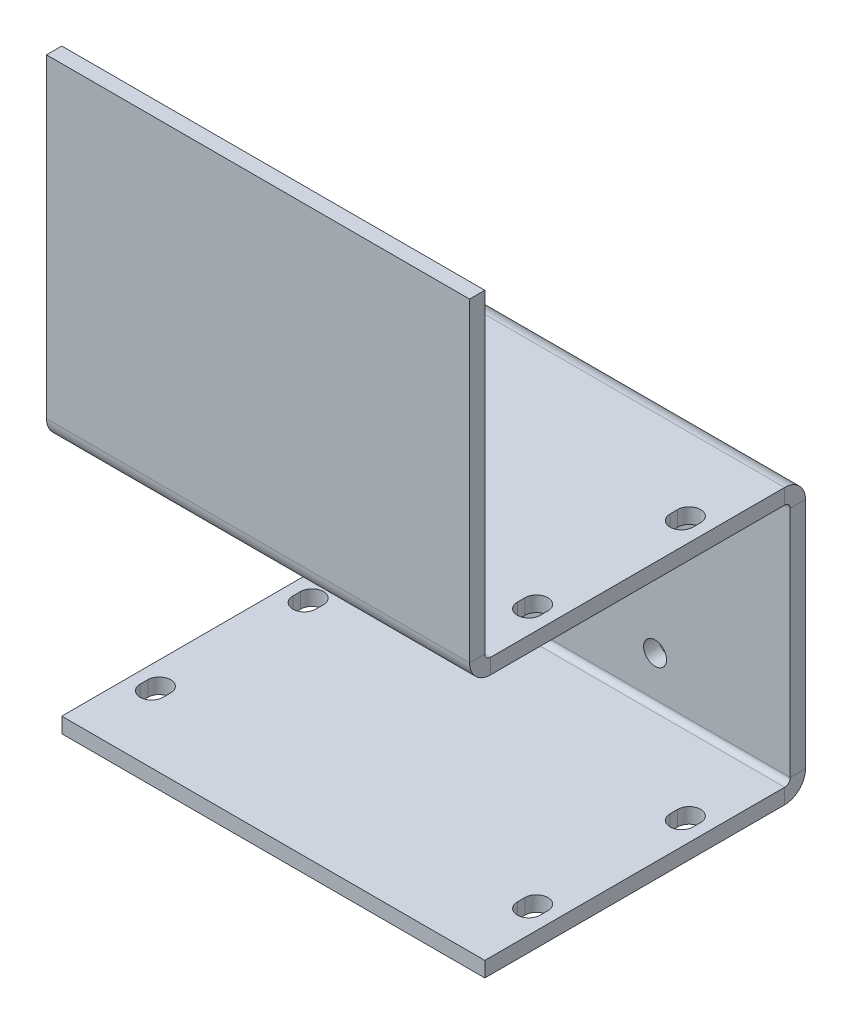
from build123d import *

# Parameters (mm, degrees)
SZKIC1_W                             = 55.4
SZKIC1_H                             = 32
ODGI_CIE_BAZOWE1_DEPTH               = 2
OTWORY_USTALAJ_CE_3_0MM1_D           = 3
OTWORY_USTALAJ_CE_3_0MM1_DEPTH       = 17
OTWORY_USTALAJ_CE_3_0MM1_TIP         = 0.901290929
ODGI_CIE_KRAW_DZI1_STRIP_W           = 9.4732
ODGI_CIE_KRAW_DZI1_STRIP_H           = 2
ODGI_CIE_KRAW_DZI1_STRIP_CUT_DEPTH   = 55.4
ODGI_CIE_KRAW_DZI1_STRIP_2_W         = 9.4732
ODGI_CIE_KRAW_DZI1_STRIP_2_H         = 2
ODGI_CIE_KRAW_DZI1_STRIP_CUT_2_DEPTH = 55.4
ODGI_CIE_KRAW_DZI1_DEPTH             = 55.4
ODGI_CIE_KRAW_DZI1_BEND_DEPTH        = 55.4
ODGI_CIE_KRAW_DZI2_STRIP_W           = 9.4732
ODGI_CIE_KRAW_DZI2_STRIP_H           = 2
ODGI_CIE_KRAW_DZI2_STRIP_CUT_DEPTH   = 55.4
ODGI_CIE_KRAW_DZI2_DEPTH             = 55.4
WYTNIJ_WYCI_GNI_CIE1_DEPTH           = 66.53846199


# Sheet-metal steps are written as plain solids
with BuildPart() as part:
    # Szkic1 → Odgięcie bazowe1 (new body)
    with BuildSketch(Plane.XY):
        Rectangle(SZKIC1_W, SZKIC1_H)
    extrude(amount=-ODGI_CIE_BAZOWE1_DEPTH)

    # Otwory ustalające Ø3.0mm1
    with Locations(Plane(origin=(0, 0, -2), x_dir=(-1, 0, 0), z_dir=(0, 0, -1))):
        with Locations((-10, 10), (10, 10), (10, -10), (-10, -10)):
            Hole(OTWORY_USTALAJ_CE_3_0MM1_D / 2, depth=OTWORY_USTALAJ_CE_3_0MM1_DEPTH)
            with Locations((0, 0, -(OTWORY_USTALAJ_CE_3_0MM1_DEPTH + OTWORY_USTALAJ_CE_3_0MM1_TIP / 2))):  # 118° drill point
                Cone(0, OTWORY_USTALAJ_CE_3_0MM1_D / 2, OTWORY_USTALAJ_CE_3_0MM1_TIP, mode=Mode.SUBTRACT)

    # Odgięcie krawędzi1 strip (across the edge) → Odgięcie krawędzi1 strip cut (cut)
    with BuildSketch(Plane(origin=(27.7, 16, 0), x_dir=(0, -1, 0), z_dir=(-1, 0, 0))):
        with Locations((-4, -1)):
            Rectangle(ODGI_CIE_KRAW_DZI1_STRIP_W, ODGI_CIE_KRAW_DZI1_STRIP_H)
    extrude(amount=ODGI_CIE_KRAW_DZI1_STRIP_CUT_DEPTH, mode=Mode.SUBTRACT)

    # Odgięcie krawędzi1 strip 2 (across the edge) → Odgięcie krawędzi1 strip cut 2 (cut)
    with BuildSketch(Plane(origin=(-27.7, -16, 0), x_dir=(0, 1, 0), z_dir=(1, 0, 0))):
        with Locations((-4, -1)):
            Rectangle(ODGI_CIE_KRAW_DZI1_STRIP_2_W, ODGI_CIE_KRAW_DZI1_STRIP_2_H)
    extrude(amount=ODGI_CIE_KRAW_DZI1_STRIP_CUT_2_DEPTH, mode=Mode.SUBTRACT)

    # Odgięcie krawędzi1 section (across the edge) → Odgięcie krawędzi1 (add)
    with BuildSketch(Plane(origin=(27.7, 16, 0), x_dir=(0, -1, 0), z_dir=(-1, 0, 0))):
        with BuildLine():
            Line((-2, 0.7366), (-2, 40))
            Line((-2, 40), (0, 40))
            Line((0, 40), (0, 0.7366))
            ThreePointArc((0, 0.7366), (0.215745145, 0.215745145), (0.7366, 0))
            Line((0.7366, 0), (0.7366, -2))
            ThreePointArc((0.7366, -2), (-1.198468417, -1.198468417), (-2, 0.7366))
        make_face()
    extrude(amount=ODGI_CIE_KRAW_DZI1_DEPTH)

    # Odgięcie krawędzi1 section 2 (across the edge) → Odgięcie krawędzi1 bend (add)
    with BuildSketch(Plane(origin=(-27.7, -16, 0), x_dir=(0, 1, 0), z_dir=(1, 0, 0))):
        with BuildLine():
            Line((-2, 0.7366), (-2, 40))
            Line((-2, 40), (0, 40))
            Line((0, 40), (0, 0.7366))
            ThreePointArc((0, 0.7366), (0.215745145, 0.215745145), (0.7366, 0))
            Line((0.7366, 0), (0.7366, -2))
            ThreePointArc((0.7366, -2), (-1.198468417, -1.198468417), (-2, 0.7366))
        make_face()
    extrude(amount=ODGI_CIE_KRAW_DZI1_BEND_DEPTH)

    # Odgięcie krawędzi2 strip (across the edge) → Odgięcie krawędzi2 strip cut (cut)
    with BuildSketch(Plane(origin=(-27.7, 18, 40), x_dir=(0, 0, -1), z_dir=(1, 0, 0))):
        with Locations((-4, -1)):
            Rectangle(ODGI_CIE_KRAW_DZI2_STRIP_W, ODGI_CIE_KRAW_DZI2_STRIP_H)
    extrude(amount=ODGI_CIE_KRAW_DZI2_STRIP_CUT_DEPTH, mode=Mode.SUBTRACT)

    # Odgięcie krawędzi2 section (across the edge) → Odgięcie krawędzi2 (add)
    with BuildSketch(Plane(origin=(-27.7, 18, 40), x_dir=(0, 0, -1), z_dir=(1, 0, 0))):
        with BuildLine():
            Line((-2, 0.7366), (-2, 42))
            Line((-2, 42), (0, 42))
            Line((0, 42), (0, 0.7366))
            ThreePointArc((0, 0.7366), (0.215745145, 0.215745145), (0.7366, 0))
            Line((0.7366, 0), (0.7366, -2))
            ThreePointArc((0.7366, -2), (-1.198468417, -1.198468417), (-2, 0.7366))
        make_face()
    extrude(amount=ODGI_CIE_KRAW_DZI2_DEPTH)

    # Szkic16 → Wytnij-wyciągnięcie1 (cut, through all)
    with BuildSketch(Plane(origin=(0, 18, 0), x_dir=(1, 0, 0), z_dir=(0, 1, 0))):
        with BuildLine():
            Line((26.2, -30.2366), (26.2, -31.2366))
            ThreePointArc((26.2, -31.2366), (24.7, -32.7366), (23.2, -31.2366))
            Line((23.2, -31.2366), (23.2, -30.2366))
            ThreePointArc((23.2, -30.2366), (24.7, -28.7366), (26.2, -30.2366))
        make_face()
        with BuildLine():
            Line((26.2, -10.2366), (26.2, -11.2366))
            ThreePointArc((26.2, -11.2366), (24.7, -12.7366), (23.2, -11.2366))
            Line((23.2, -11.2366), (23.2, -10.2366))
            ThreePointArc((23.2, -10.2366), (24.7, -8.7366), (26.2, -10.2366))
        make_face()
        with BuildLine():
            Line((-26.2, -10.2366), (-26.2, -11.2366))
            ThreePointArc((-26.2, -11.2366), (-24.7, -12.7366), (-23.2, -11.2366))
            Line((-23.2, -11.2366), (-23.2, -10.2366))
            ThreePointArc((-23.2, -10.2366), (-24.7, -8.7366), (-26.2, -10.2366))
        make_face()
        with BuildLine():
            Line((-26.2, -30.2366), (-26.2, -31.2366))
            ThreePointArc((-26.2, -31.2366), (-24.7, -32.7366), (-23.2, -31.2366))
            Line((-23.2, -31.2366), (-23.2, -30.2366))
            ThreePointArc((-23.2, -30.2366), (-24.7, -28.7366), (-26.2, -30.2366))
        make_face()
    extrude(amount=-WYTNIJ_WYCI_GNI_CIE1_DEPTH, mode=Mode.SUBTRACT)


solid = part.part
